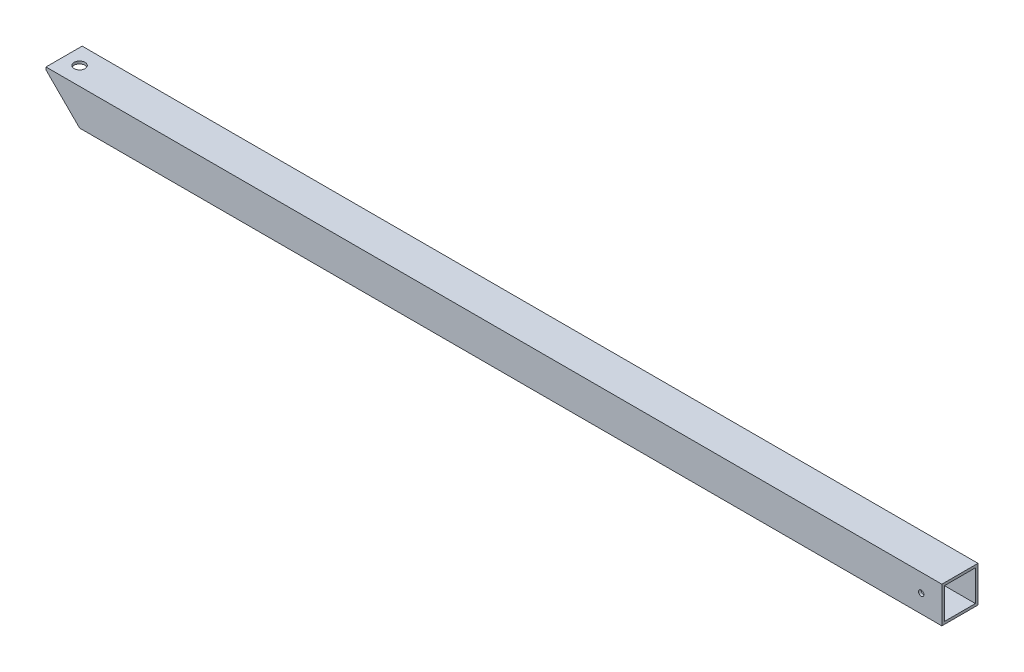
from build123d import *

# Parameters (mm, degrees)
SKETCH1_R               = 3.3147
BOSS_EXTRUDE1_DEPTH     = 22.225
SHELL1_START            = -19.05
SHELL1_OUTLINE_R        = 3.3147
SHELL1_DEPTH            = 38.1
F_1_2_CLEARANCE_HOLE1_D = 13.49248


# Read off the part's stored shape, not the designer's step: Shell1
with BuildPart() as part:
    # Sketch1 → Boss-Extrude1 (new, symmetric)
    with BuildSketch(Plane.XY):
        Polygon((41.275, -44.45), (1101.725, -44.45), (1101.725, 0), (0, 0), (0, -3.175), align=None)
        with Locations((1076.325, -22.225)):
            Circle(SKETCH1_R, mode=Mode.SUBTRACT)
    extrude(amount=BOSS_EXTRUDE1_DEPTH, both=True)

    # Shell1 outline → Shell1 (cut)
    with BuildSketch(Plane.XY.offset(SHELL1_START)):
        Polygon((38.1, -41.275), (1101.725, -41.275), (1101.725, -3.175), (0, -3.175), align=None)
        with Locations((1076.325, -22.225)):
            Circle(SHELL1_OUTLINE_R, mode=Mode.SUBTRACT)
    extrude(amount=SHELL1_DEPTH, mode=Mode.SUBTRACT)

    # 1/2 Clearance Hole1 (through all)
    with Locations(Plane(origin=(0, 0, 0), x_dir=(1, 0, 0), z_dir=(0, 1, 0))):
        with Locations((19.05, 0)):
            Hole(F_1_2_CLEARANCE_HOLE1_D / 2)


solid = part.part
